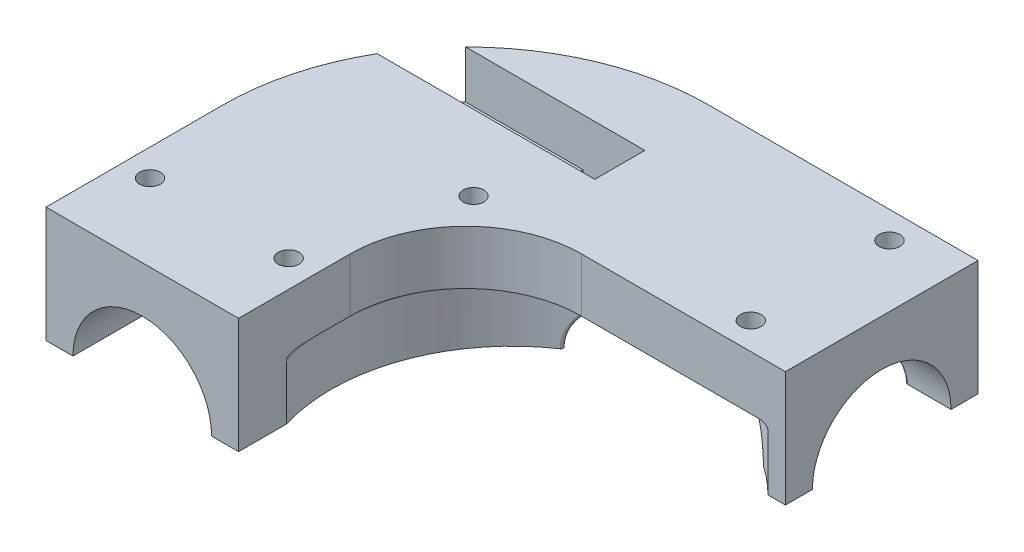
from build123d import *

# Parameters (mm, degrees)
EXTRUDE_1_DEPTH     = 15
SKETCH_2_R          = 9
SKETCH_4_R          = 23.5
CUT_EXTRUDE_1_DEPTH = 8
SKETCH_5_W          = 32.5
SKETCH_5_H          = 6.5
CUT_EXTRUDE_2_DEPTH = 6.2
FILLET_1_R          = 0.8
FILLET_2_R          = 0.3
SKETCH_7_R          = 1.35
CUT_EXTRUDE_4_DEPTH = 5
CUT_EXTRUDE_START   = -0.913768
SKETCH_8_W          = 8
SKETCH_8_H          = 6.5
CUT_EXTRUDE_5_DEPTH = 0.913768


with BuildPart() as part:
    # 草图1 → 凸台-拉伸1 (new body)
    with BuildSketch(Plane(origin=(0, 0, 0), x_dir=(1, 0, 0), z_dir=(0, 1, 0))):
        with BuildLine():
            Line((-66.5, -42), (-66.5, -19.04554885))
            ThreePointArc((-66.5, -19.04554885), (-57.260522658, 3.260522658), (-34.95445115, 12.5))
            Line((-34.95445115, 12.5), (0, 12.5))
            Line((0, 12.5), (0, -12.5))
            Line((0, -12.5), (-26.5, -12.5))
            ThreePointArc((-26.5, -12.5), (-37.106601718, -16.893398282), (-41.5, -27.5))
            Line((-41.5, -27.5), (-41.5, -42))
            Line((-41.5, -42), (-66.5, -42))
        make_face()
    extrude(amount=EXTRUDE_1_DEPTH)

    # 切除-扫描1: sweep along a path in 草图3
    with BuildLine(Plane.XZ) as sweep_1_path:
        Line((-54, 42), (-54, 19.04554885))
        ThreePointArc((-54, 19.04554885), (-48.421687893, 5.578312107), (-34.95445115, 0))
        Line((-34.95445115, 0), (0, 0))
    # 草图2 → 切除-扫描1 (sweep, cut)
    with BuildSketch(Plane.XY.offset(42)):
        with Locations((-54, 0)):
            Circle(SKETCH_2_R)
    sweep(path=sweep_1_path.line, mode=Mode.SUBTRACT)

    # 草图4 → 切除-拉伸1 (cut)
    with BuildSketch(Plane.XZ):
        with Locations((-19, 29)):
            Circle(SKETCH_4_R)
        with Locations((-19, -29)):
            Circle(SKETCH_4_R)
    extrude(amount=-CUT_EXTRUDE_1_DEPTH, mode=Mode.SUBTRACT)

    # 草图5 → 切除-拉伸2 (cut)
    with BuildSketch(Plane(origin=(0, 15, 0), x_dir=(1, 0, 0), z_dir=(0, 1, 0))):
        with Locations((-50.25, 0)):
            Rectangle(SKETCH_5_W, SKETCH_5_H)
    extrude(amount=-CUT_EXTRUDE_2_DEPTH, mode=Mode.SUBTRACT)

    # 圆角1
    fillet_1_edges = [part.edges().sort_by_distance(p)[0] for p in [
        (-18.993407048, 8, -5.500000925),
        (-30.992944442, 8, 8.790613972),
    ]]
    fillet(fillet_1_edges, radius=FILLET_1_R)

    # 圆角2
    fillet_2_edges = [part.edges().sort_by_distance(p)[0] for p in [
        (-19, 7.123903424, 5.5),
        (-19, 7.123903424, -5.5),
    ]]
    fillet(fillet_2_edges, radius=FILLET_2_R)

    # 草图7 → 切除-拉伸4 (cut)
    with BuildSketch(Plane(origin=(0, 15, 0), x_dir=(1, 0, 0), z_dir=(0, 1, 0))):
        with Locations(Location((-45, -32, 0), (0, 0, 270))):
            Circle(SKETCH_7_R)
        with Locations(Location((-63, -32, 0), (0, 0, 270))):
            Circle(SKETCH_7_R)
        with Locations(Location((-8, -9, 0), (0, 0, 270))):
            Circle(SKETCH_7_R)
        with Locations(Location((-8, 9, 0), (0, 0, 270))):
            Circle(SKETCH_7_R)
        with Locations(Location((-40, -13, 0), (0, 0, 270))):
            Circle(SKETCH_7_R)
    extrude(amount=-CUT_EXTRUDE_4_DEPTH, mode=Mode.SUBTRACT)

    # 草图8 → 切除-拉伸5 (cut)
    with BuildSketch(Plane(origin=(0, 8.8, 0), x_dir=(1, 0, 0), z_dir=(0, 1, 0)).offset(CUT_EXTRUDE_START)):
        with Locations((-38, 0)):
            Rectangle(SKETCH_8_W, SKETCH_8_H)
    extrude(amount=CUT_EXTRUDE_5_DEPTH, mode=Mode.SUBTRACT)


solid = part.part
